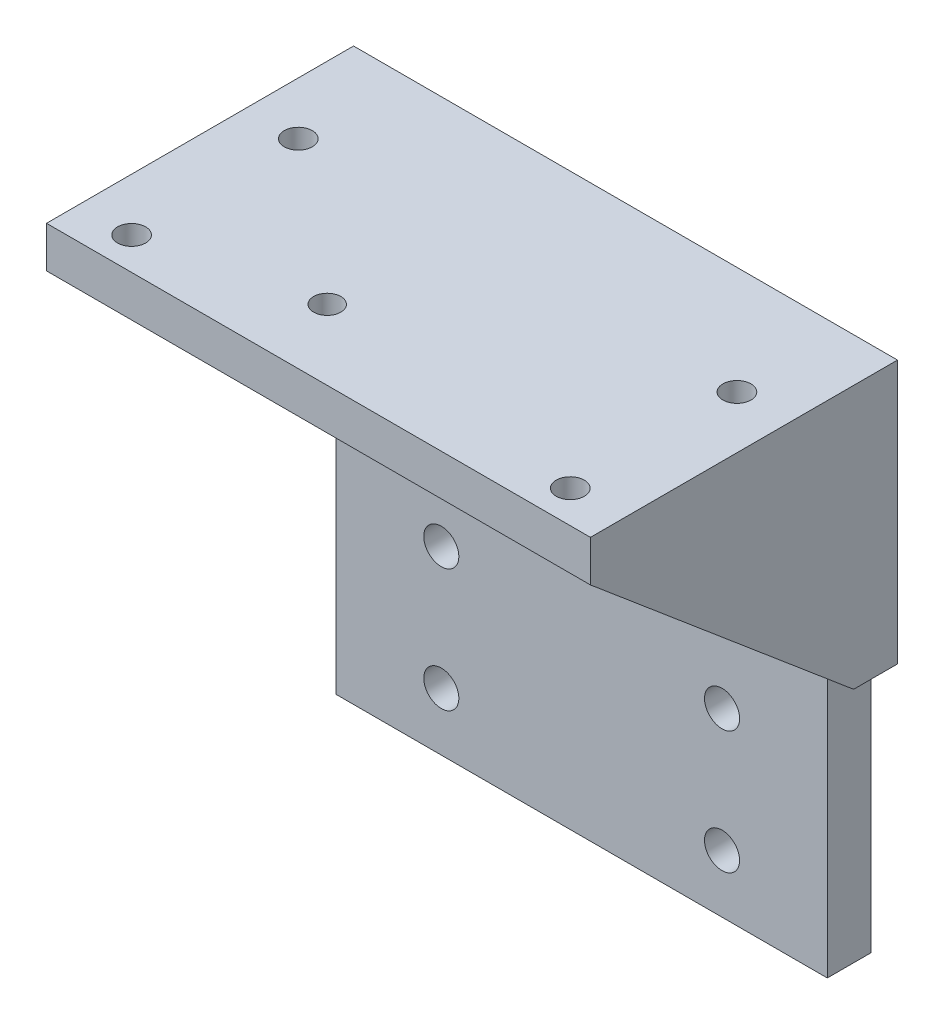
from build123d import *

# Parameters (mm, degrees)
SKETCH_1_W          = 56
SKETCH_1_H          = 60
EXTRUDE_1_DEPTH     = 5
SKETCH_2_R          = 2
CUT_EXTRUDE_1_DEPTH = 5
SKETCH_3_W          = 56
SKETCH_3_H          = 4.7
EXTRUDE_2_DEPTH     = 30
SKETCH_4_R          = 1.55
CUT_EXTRUDE_2_DEPTH = 40
SKETCH_5_W          = 25
SKETCH_5_H          = 24
EXTRUDE_3_DEPTH     = 4.3
EXTRUDE_4_DEPTH     = 3
SKETCH_8_R          = 1.6
CUT_EXTRUDE_3_DEPTH = 5


with BuildPart() as part:
    # 草图1 → 凸台-拉伸1 (new body)
    with BuildSketch(Plane.XY):
        Rectangle(SKETCH_1_W, SKETCH_1_H)
    extrude(amount=EXTRUDE_1_DEPTH)

    # 草图2 → 切除-拉伸1 (cut)
    with BuildSketch(Plane.XY.offset(5)):
        with Locations((-16, -23.4)):
            Circle(SKETCH_2_R)
        with Locations((-16, -9.4)):
            Circle(SKETCH_2_R)
    cut_extrude_1 = extrude(amount=-CUT_EXTRUDE_1_DEPTH, mode=Mode.SUBTRACT)

    # 镜向1: 切除-拉伸1 across plane
    add(cut_extrude_1.mirror(Plane(origin=(0, 0, 0), x_dir=(0, 0, 1), z_dir=(1, 0, 0))), mode=Mode.SUBTRACT)

    # 草图3 → 凸台-拉伸2 (add)
    with BuildSketch(Plane.XY.offset(5)):
        with Locations((0, 27.65)):
            Rectangle(SKETCH_3_W, SKETCH_3_H)
    extrude(amount=EXTRUDE_2_DEPTH)

    # 草图4 → 切除-拉伸2 (cut)
    with BuildSketch(Plane(origin=(0, 30, 0), x_dir=(1, 0, 0), z_dir=(0, 1, 0))):
        with Locations((-7, -27)):
            Circle(SKETCH_4_R)
    extrude(amount=-CUT_EXTRUDE_2_DEPTH, mode=Mode.SUBTRACT)

    # 草图5 → 凸台-拉伸3 (add)
    with BuildSketch(Plane.XY.offset(5)):
        with Locations((-15.5, 13.3)):
            Rectangle(SKETCH_5_W, SKETCH_5_H)
    extrude(amount=EXTRUDE_3_DEPTH)

    # 草图6 → 凸台-拉伸4 (add)
    with BuildSketch(Plane.ZY.offset(28)):
        Polygon((0, 30), (0, 0), (5, 0), (35, 25.3), (35, 30), align=None)
    extrude_4 = extrude(amount=EXTRUDE_4_DEPTH)

    # 镜向2: 凸台-拉伸4 across plane
    add(extrude_4.mirror(Plane(origin=(0, 0, 0), x_dir=(0, 0, 1), z_dir=(1, 0, 0))))

    # 草图8 → 切除-拉伸3 (cut)
    with BuildSketch(Plane.XZ.offset(-25.3)):
        with Locations((-25, 31.3)):
            Circle(SKETCH_8_R)
        with Locations((25, 31.3)):
            Circle(SKETCH_8_R)
        with Locations((25, 12.3)):
            Circle(SKETCH_8_R)
        with Locations((-25, 12.3)):
            Circle(SKETCH_8_R)
    extrude(amount=-CUT_EXTRUDE_3_DEPTH, mode=Mode.SUBTRACT)


solid = part.part
